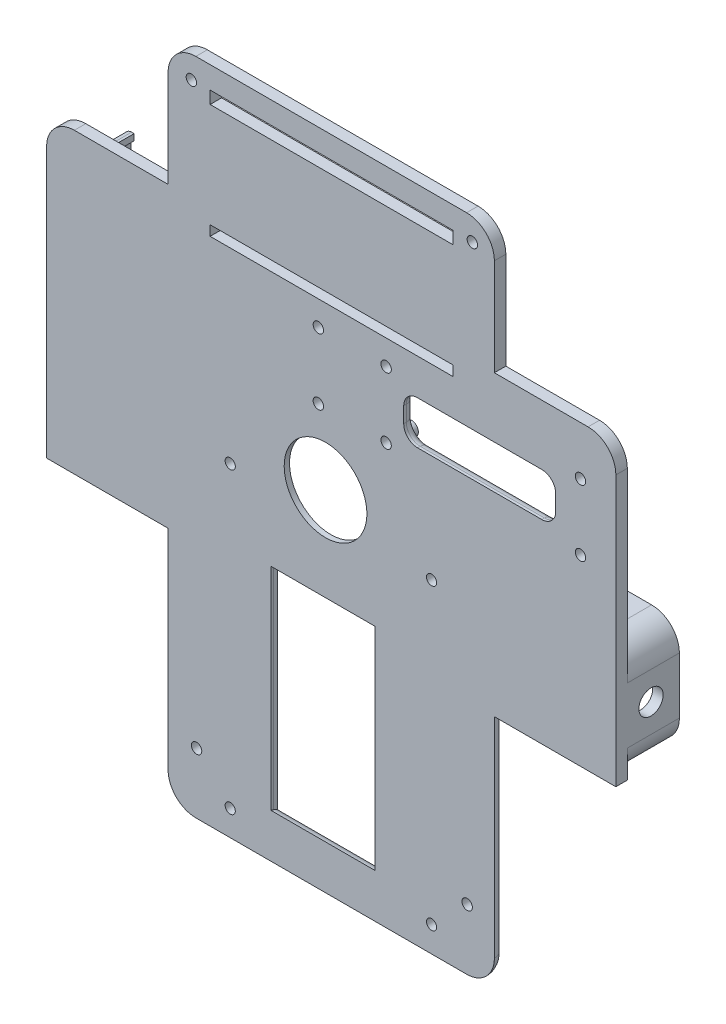
from build123d import *

# Parameters (mm, degrees)
SKETCH1_R                                       = 1.5
BOSS_EXTRUDE2_DEPTH                             = 3.302
BOSS_EXTRUDE20_DEPTH                            = 3.302
SKETCH5_R                                       = 2.5
JETSON_MOUNT_DEPTH                              = 5
CSK_FOR_M3_FLAT_HEAD_MACHINE_SCREW1_D           = 2.93
CSK_FOR_M3_FLAT_HEAD_MACHINE_SCREW1_CSINK_D     = 6.3
CSK_FOR_M3_FLAT_HEAD_MACHINE_SCREW1_CSINK_ANGLE = 90
SKETCH20_W                                      = 30
SKETCH20_H                                      = 60.922176561
CUT_EXTRUDE3_DEPTH                              = 130.896418456
SKETCH49_R                                      = 11.909888474
WIRE_HOLE_DEPTH                                 = 130.896418456
SKETCH41_R                                      = 2
MULTIPLXR_MOUNT_DEPTH                           = 4
SKETCH33_R                                      = 2
RC_MULTIPL_DEPTH                                = 4
F_3_0MM_DOWEL_HOLE2_D                           = 3
F_3_0MM_DOWEL_HOLE3_D                           = 3
FILLET1_R                                       = 3.4976
FILLET3_R                                       = 3.8024
FILLET4_R                                       = 3.2436
CHAMFER1_SIZE                                   = 4.699
CHAMFER1_SIZE2                                  = 1.766953129
SKETCH50_R                                      = 3.162803582
RC_MULT_SPRT_DEPTH                              = 3.048
ANT_MOUNT_DEPTH                                 = 15
SKETCH54_R                                      = 3.5
ANT1_HOLE_DEPTH                                 = 15
ANT2_HOLE_START                                 = -15
SKETCH55_R                                      = 3.5
ANT2_HOLE_DEPTH                                 = 15
SKETCH56_W                                      = 20
SKETCH56_H                                      = 37
RX_HOLDER_DEPTH                                 = 13
SKETCH57_W                                      = 18.375973559
SKETCH57_H                                      = 5.833429496
RX_ANT_CUTOUT_DEPTH                             = 13
SKETCH59_W                                      = 70
SKETCH59_H                                      = 2.892085802
SKETCH59_H_2                                    = 3.6
CUT_EXTRUDE8_DEPTH                              = 13
CUT_EXTRUDE9_DEPTH                              = 13
FILLET5_R                                       = 2.54
FILLET6_R                                       = 2.54


with BuildPart() as part:
    # Sketch1 → Boss-Extrude2 (new body)
    with BuildSketch(Plane.XY):
        with BuildLine():
            Line((38.819226671, -100.501131943), (-39.180773329, -100.501131943))
            ThreePointArc((-39.180773329, -100.501131943), (-44.837627579, -98.157986192), (-47.180773329, -92.501131943))
            Line((-47.180773329, -92.501131943), (-47.180773329, 81.498868057))
            ThreePointArc((-47.180773329, 81.498868057), (-44.837627579, 87.155722307), (-39.180773329, 89.498868057))
            Line((-39.180773329, 89.498868057), (38.819226671, 89.498868057))
            ThreePointArc((38.819226671, 89.498868057), (44.47608092, 87.155722307), (46.819226671, 81.498868057))
            Line((46.819226671, 81.498868057), (46.819226671, -92.501131943))
            ThreePointArc((46.819226671, -92.501131943), (44.47608092, -98.157986192), (38.819226671, -100.501131943))
        make_face()
        with Locations(Location((-40.480046806, 82.97456797, 0), (0, 0, 180))):
            Circle(SKETCH1_R, mode=Mode.SUBTRACT)
        with Locations(Location((-38.980046806, -83.006600326, 0), (0, 0, 180))):
            Circle(SKETCH1_R, mode=Mode.SUBTRACT)
        with Locations(Location((38.980046806, -83.006600326, 0), (0, 0, 180))):
            Circle(SKETCH1_R, mode=Mode.SUBTRACT)
        with Locations(Location((40.480046806, 82.97456797, 0), (0, 0, 180))):
            Circle(SKETCH1_R, mode=Mode.SUBTRACT)
    extrude(amount=BOSS_EXTRUDE2_DEPTH)

    # Sketch51 → Boss-Extrude20 (add)
    with BuildSketch(Plane(origin=(0, 0, 0), x_dir=(-1, 0, 0), z_dir=(0, 0, -1))):
        with BuildLine():
            Line((47.180773329, 53.567173742), (74.180773329, 53.567173742))
            ThreePointArc((74.180773329, 53.567173742), (79.837627579, 51.224027992), (82.180773329, 45.567173742))
            Line((82.180773329, 45.567173742), (82.180773329, -32.23463236))
            Line((82.180773329, -32.23463236), (47.180773329, -32.23463236))
            Line((47.180773329, -32.23463236), (47.180773329, 53.567173742))
        make_face()
        with BuildLine():
            Line((-46.819226671, 53.567173742), (-73.819226671, 53.567173742))
            ThreePointArc((-73.819226671, 53.567173742), (-79.47608092, 51.224027992), (-81.819226671, 45.567173742))
            Line((-81.819226671, 45.567173742), (-81.819226671, -32.23463236))
            Line((-81.819226671, -32.23463236), (-46.819226671, -32.23463236))
            Line((-46.819226671, -32.23463236), (-46.819226671, 53.567173742))
        make_face()
    extrude(amount=-BOSS_EXTRUDE20_DEPTH)

    # Sketch5 → jetson-mount (add)
    with BuildSketch(Plane(origin=(0, 0, 0), x_dir=(-1, 0, 0), z_dir=(0, 0, -1))):
        with Locations(Location((-28.718454916, -7.157016581, 0), (0, 0, 180))):
            Circle(SKETCH5_R)
        with Locations(Location((-28.718454916, -93.136016581, 0), (0, 0, 180))):
            Circle(SKETCH5_R)
        with Locations(Location((29.281545084, -93.136016581, 0), (0, 0, 180))):
            Circle(SKETCH5_R)
        with Locations(Location((29.281545084, -7.157016581, 0), (0, 0, 180))):
            Circle(SKETCH5_R)
    extrude(amount=JETSON_MOUNT_DEPTH)

    # CSK for M3 Flat Head Machine Screw1 (through all)
    with Locations(Plane(origin=(0, 0, -5), x_dir=(-1, 0, 0), z_dir=(0, 0, -1))):
        with Locations((-28.718454916, -7.157016581), (29.281545084, -7.157016581), (-28.718454916, -93.136016581), (29.281545084, -93.136016581)):
            CounterSinkHole(CSK_FOR_M3_FLAT_HEAD_MACHINE_SCREW1_D / 2, CSK_FOR_M3_FLAT_HEAD_MACHINE_SCREW1_CSINK_D / 2, counter_sink_angle=CSK_FOR_M3_FLAT_HEAD_MACHINE_SCREW1_CSINK_ANGLE)

    # Sketch20 → Cut-Extrude3 (cut, through all)
    with BuildSketch(Plane(origin=(0, 0, 0), x_dir=(-1, 0, 0), z_dir=(0, 0, -1))):
        with Locations((2.518524865, -57.349020558)):
            Rectangle(SKETCH20_W, SKETCH20_H)
    extrude(amount=-CUT_EXTRUDE3_DEPTH, mode=Mode.SUBTRACT)

    # Sketch49 → wire-hole (cut, through all)
    with BuildSketch(Plane(origin=(0, 0, 0), x_dir=(-1, 0, 0), z_dir=(0, 0, -1))):
        with Locations((1.827071615, 0)):
            Circle(SKETCH49_R)
    extrude(amount=-WIRE_HOLE_DEPTH, mode=Mode.SUBTRACT)

    # Sketch41 → multiplxr-mount (add)
    with BuildSketch(Plane(origin=(0, 0, 0), x_dir=(-1, 0, 0), z_dir=(0, 0, -1))):
        with Locations(Location((-71.62805428, 39.504614291, 0), (0, 0, 180))):
            Circle(SKETCH41_R)
        with Locations(Location((-71.62805428, 20.504614291, 0), (0, 0, 180))):
            Circle(SKETCH41_R)
        with Locations(Location((-15.62805428, 20.504614291, 0), (0, 0, 180))):
            Circle(SKETCH41_R)
        with Locations(Location((-15.62805428, 39.504614291, 0), (0, 0, 180))):
            Circle(SKETCH41_R)
    extrude(amount=MULTIPLXR_MOUNT_DEPTH)

    # Sketch33 → rc-multipl (add)
    with BuildSketch(Plane(origin=(0, 0, 0), x_dir=(-1, 0, 0), z_dir=(0, 0, -1))):
        with Locations(Location((3.894097035, 39.518619169, 0), (0, 0, 180))):
            Circle(SKETCH33_R)
        with Locations(Location((3.894098263, 20.518619169, 0), (0, 0, 180))):
            Circle(SKETCH33_R)
    extrude(amount=RC_MULTIPL_DEPTH)

    # Ø3.0mm Dowel Hole2 (through all)
    with Locations(Plane(origin=(0, 0, -4), x_dir=(-1, 0, 0), z_dir=(0, 0, -1))):
        with Locations((3.894097035, 39.518619169), (3.894098263, 20.518619169)):
            Hole(F_3_0MM_DOWEL_HOLE2_D / 2)

    # Ø3.0mm Dowel Hole3 (through all)
    with Locations(Plane(origin=(0, 0, -4), x_dir=(-1, 0, 0), z_dir=(0, 0, -1))):
        with Locations((-71.62805428, 39.504614291), (-71.62805428, 20.504614291), (-15.62805428, 20.504614291), (-15.62805428, 39.504614291)):
            Hole(F_3_0MM_DOWEL_HOLE3_D / 2)

    # Fillet1
    # the kernel refuses this fillet: 3.4976 mm, written as the material it takes off along each edge
    with BuildSketch(Plane(origin=(12.481475135, -26.887932277, 0), x_dir=(0, 1, 0), z_dir=(-1, 0, 0))) as fillet1_piece_1:
        with BuildLine():
            CenterArc((3.492126344, -3.4976), FILLET1_R, 90, 86.794114711)
            Line((0, -3.302), (-0.069842527, -3.298088))
            ThreePointArc((-0.069842527, -3.298088), (-0.069952, -1.651), (-0.069952, 0))
            Line((-0.069952, 0), (0, 0.069952))
            Line((0, 0.069952), (3.492126344, 0.069952))
            Line((3.492126344, 0.069952), (3.492126344, 0))
        make_face()
    extrude(amount=30, mode=Mode.SUBTRACT)

    # Fillet3
    # the kernel refuses this fillet: 3.8024 mm, written as the material it takes off along each edge
    with BuildSketch(Plane(origin=(-17.518524865, -87.810108838, 0), x_dir=(0, 0, 1), z_dir=(1, 0, 0))) as fillet3_piece_1:
        with BuildLine():
            CenterArc((3.8024, 3.769329596), FILLET3_R, 180, 82.437876781)
            Line((0, 3.769329596), (-0.076048, 3.769329596))
            Line((-0.076048, 3.769329596), (-0.076048, 0))
            Line((-0.076048, 0), (0, -0.076048))
            ThreePointArc((0, -0.076048), (1.651, -0.076048), (3.291992, -0.075386592))
            Line((3.291992, -0.075386592), (3.302, 0))
        make_face()
    extrude(amount=30, mode=Mode.SUBTRACT)

    # Fillet4
    fillet4_edges = [part.edges().sort_by_distance(p)[0] for p in [
        (46.819226671, -62.367882152, 0),
        (44.47608092, -98.157986192, 0),
        (-0.180773329, -100.501131943, 0),
        (-44.837627579, -98.157986192, 0),
        (-47.180773329, -62.367882152, 0),
    ]]
    fillet(fillet4_edges, radius=FILLET4_R)

    # Chamfer1
    chamfer1_edges = [part.edges().sort_by_distance(p)[0] for p in [
        (10.082816859, 0, 0),
    ]]
    chamfer1_side = [part.faces().sort_by_distance(p)[0] for p in [
        (62.697426671, -29.74919572, 0),
    ]]
    chamfer(chamfer1_edges, length=CHAMFER1_SIZE, length2=CHAMFER1_SIZE2, reference=chamfer1_side[0])

    # Sketch50 → rc-mult-sprt (add)
    with BuildSketch(Plane(origin=(0, 0, 0), x_dir=(-1, 0, 0), z_dir=(0, 0, -1))):
        with Locations(Location((21.93357179, 29.634325749, 0), (0, 0, 180))):
            Circle(SKETCH50_R)
    extrude(amount=RC_MULT_SPRT_DEPTH)

    # Sketch53 → ant-mount (add)
    with BuildSketch(Plane(origin=(0, 0, 0), x_dir=(-1, 0, 0), z_dir=(0, 0, -1))):
        with BuildLine():
            Line((-73.819226671, 0), (-66.819226671, 0))
            Line((-66.819226671, 0), (-73.787648749, -2.784427553))
            ThreePointArc((-73.787648749, -2.784427553), (-77.442948307, -5.727086039), (-78.819226671, -10.213321843))
            Line((-78.819226671, -10.213321843), (-78.819226671, -22.003249545))
            ThreePointArc((-78.819226671, -22.003249545), (-77.447947103, -26.482095984), (-73.804210314, -29.425504772))
            Line((-73.804210314, -29.425504772), (-66.819226671, -32.23463236))
            Line((-66.819226671, -32.23463236), (-73.819226671, -32.23463236))
            ThreePointArc((-73.819226671, -32.23463236), (-79.47608092, -29.89148661), (-81.819226671, -24.23463236))
            Line((-81.819226671, -24.23463236), (-81.819226671, -8))
            ThreePointArc((-81.819226671, -8), (-79.47608092, -2.343145751), (-73.819226671, 0))
        make_face()
        with BuildLine():
            Line((67.180773329, -32.23463236), (74.180773329, -32.23463236))
            ThreePointArc((74.180773329, -32.23463236), (79.837627579, -29.89148661), (82.180773329, -24.23463236))
            Line((82.180773329, -24.23463236), (82.180773329, -8))
            ThreePointArc((82.180773329, -8), (79.837627579, -2.343145751), (74.180773329, 0))
            Line((74.180773329, 0), (67.180773329, 0))
            Line((67.180773329, 0), (74.149195408, -2.784427553))
            ThreePointArc((74.149195408, -2.784427553), (77.804494966, -5.727086039), (79.180773329, -10.213321843))
            Line((79.180773329, -10.213321843), (79.180773329, -22.003249545))
            ThreePointArc((79.180773329, -22.003249545), (77.809493762, -26.482095984), (74.165756973, -29.425504772))
            Line((74.165756973, -29.425504772), (67.180773329, -32.23463236))
        make_face()
    extrude(amount=ANT_MOUNT_DEPTH)

    # Sketch54 → ant1-hole (cut)
    with BuildSketch(Plane(origin=(81.819226671, 0, 0), x_dir=(0, 0, -1), z_dir=(1, 0, 0))):
        with Locations(Location((6.825592487, -16.11731618, 0), (0, 0, 90))):
            Circle(SKETCH54_R)
    extrude(amount=-ANT1_HOLE_DEPTH, mode=Mode.SUBTRACT)

    # Sketch55 → ant2-hole (cut)
    with BuildSketch(Plane.ZY.offset(82.180773329).offset(ANT2_HOLE_START)):
        with Locations(Location((-6.825592487, -16.11731618, 0), (0, 0, 90))):
            Circle(SKETCH55_R)
    extrude(amount=ANT2_HOLE_DEPTH, mode=Mode.SUBTRACT)

    # Sketch56 → rx-holder (add)
    with BuildSketch(Plane(origin=(0, 0, 0), x_dir=(-1, 0, 0), z_dir=(0, 0, -1))):
        with BuildLine():
            Line((52.394460902, 43.039631321), (52.394460902, 6.439631321))
            ThreePointArc((52.394460902, 6.439631321), (52.980247339, 5.025417759), (54.394460902, 4.439631321))
            Line((54.394460902, 4.439631321), (73.994460902, 4.439631321))
            ThreePointArc((73.994460902, 4.439631321), (75.408674464, 5.025417759), (75.994460902, 6.439631321))
            Line((75.994460902, 6.439631321), (75.994460902, 43.039631321))
            ThreePointArc((75.994460902, 43.039631321), (75.408674464, 44.453844883), (73.994460902, 45.039631321))
            Line((73.994460902, 45.039631321), (54.394460902, 45.039631321))
            ThreePointArc((54.394460902, 45.039631321), (52.980247339, 44.453844883), (52.394460902, 43.039631321))
        make_face()
        with Locations((64.194460902, 24.739631321)):
            Rectangle(SKETCH56_W, SKETCH56_H, mode=Mode.SUBTRACT)
    extrude(amount=RX_HOLDER_DEPTH)

    # Sketch57 → rx-ant-cutout (cut)
    with BuildSketch(Plane(origin=(0, 45.039631321, 0), x_dir=(1, 0, 0), z_dir=(0, 1, 0))):
        with Locations((-64.082447682, 10.083285252)):
            Rectangle(SKETCH57_W, SKETCH57_H)
    extrude(amount=-RX_ANT_CUTOUT_DEPTH, mode=Mode.SUBTRACT)

    # Sketch59 → Cut-Extrude8 (cut)
    with BuildSketch(Plane(origin=(0, 0, 0), x_dir=(-1, 0, 0), z_dir=(0, 0, -1))):
        with Locations((0.073953376, 48.105136917)):
            Rectangle(SKETCH59_W, SKETCH59_H)
        with Locations((0.073953376, 81.351179818)):
            Rectangle(SKETCH59_W, SKETCH59_H_2)
    extrude(amount=-CUT_EXTRUDE8_DEPTH, mode=Mode.SUBTRACT)

    # Sketch60 → Cut-Extrude9 (cut)
    with BuildSketch(Plane(origin=(0, 0, 0), x_dir=(-1, 0, 0), z_dir=(0, 0, -1))):
        with BuildLine():
            Line((-60.488837205, 36.254049662), (-24.696817473, 36.254049662))
            ThreePointArc((-24.696817473, 36.254049662), (-21.868390348, 35.082476787), (-20.696817473, 32.254049662))
            Line((-20.696817473, 32.254049662), (-20.696817473, 27.778416134))
            ThreePointArc((-20.696817473, 27.778416134), (-21.868390348, 24.949989009), (-24.696817473, 23.778416134))
            Line((-24.696817473, 23.778416134), (-60.488837205, 23.778416134))
            ThreePointArc((-60.488837205, 23.778416134), (-63.31726433, 24.949989009), (-64.488837205, 27.778416134))
            Line((-64.488837205, 27.778416134), (-64.488837205, 32.254049662))
            ThreePointArc((-64.488837205, 32.254049662), (-63.31726433, 35.082476787), (-60.488837205, 36.254049662))
        make_face()
    extrude(amount=-CUT_EXTRUDE9_DEPTH, mode=Mode.SUBTRACT)

    # Fillet5
    fillet5_edges = [part.edges().sort_by_distance(p)[0] for p in [
        (21.868390348, 35.082476787, 0),
        (42.592827339, 36.254049662, 0),
        (63.31726433, 35.082476787, 0),
        (64.488837205, 30.016232898, 0),
        (63.31726433, 24.949989009, 0),
        (42.592827339, 23.778416134, 0),
        (21.868390348, 24.949989009, 0),
        (20.696817473, 30.016232898, 0),
    ]]
    fillet(fillet5_edges, radius=FILLET5_R)

    # Fillet6
    fillet6_edges = [part.edges().sort_by_distance(p)[0] for p in [
        (-17.518524865, -57.487622184, 0),
        (12.481475135, -57.487622184, 0),
    ]]
    fillet(fillet6_edges, radius=FILLET6_R)


solid = part.part
